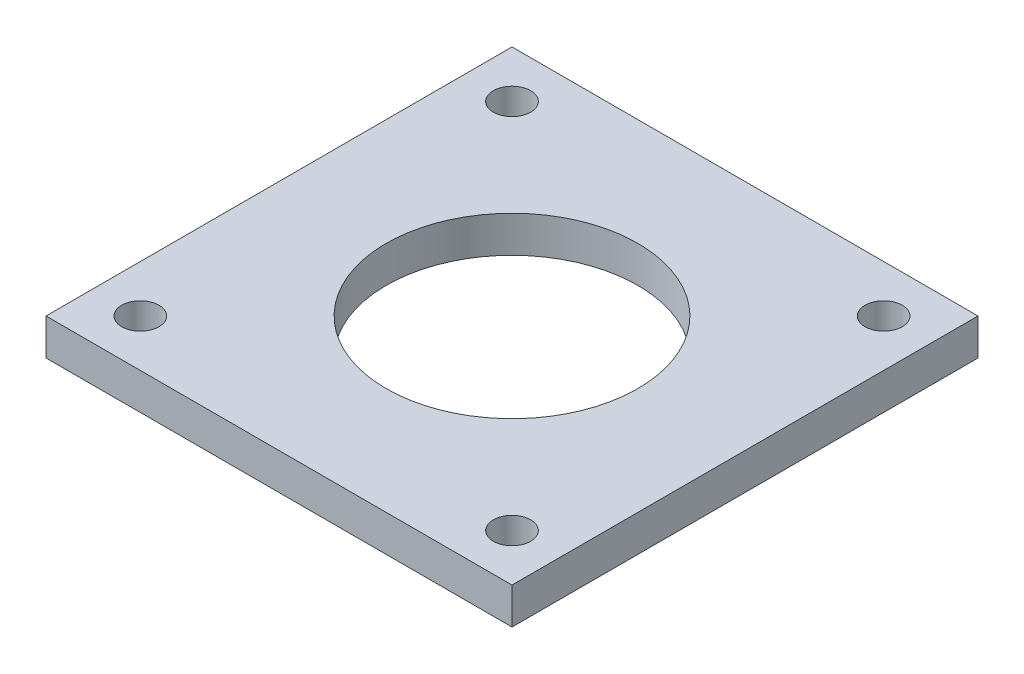
from build123d import *

# Parameters (mm, degrees)
SKETCH1_W           = 101.6
SKETCH1_H           = 101.6
SKETCH1_R           = 27.432
SKETCH1_R_2         = 4.064
BOSS_EXTRUDE1_DEPTH = 7.9375


with BuildPart() as part:
    # Sketch1 → Boss-Extrude1 (new body)
    with BuildSketch(Plane(origin=(0, 0, 0), x_dir=(1, 0, 0), z_dir=(0, 1, 0))):
        Rectangle(SKETCH1_W, SKETCH1_H)
        Circle(SKETCH1_R, mode=Mode.SUBTRACT)
        with Locations((-40.513, 40.513)):
            Circle(SKETCH1_R_2, mode=Mode.SUBTRACT)
        with Locations((40.513, 40.513)):
            Circle(SKETCH1_R_2, mode=Mode.SUBTRACT)
        with Locations((-40.513, -40.513)):
            Circle(SKETCH1_R_2, mode=Mode.SUBTRACT)
        with Locations((40.513, -40.513)):
            Circle(SKETCH1_R_2, mode=Mode.SUBTRACT)
    extrude(amount=BOSS_EXTRUDE1_DEPTH)


solid = part.part
